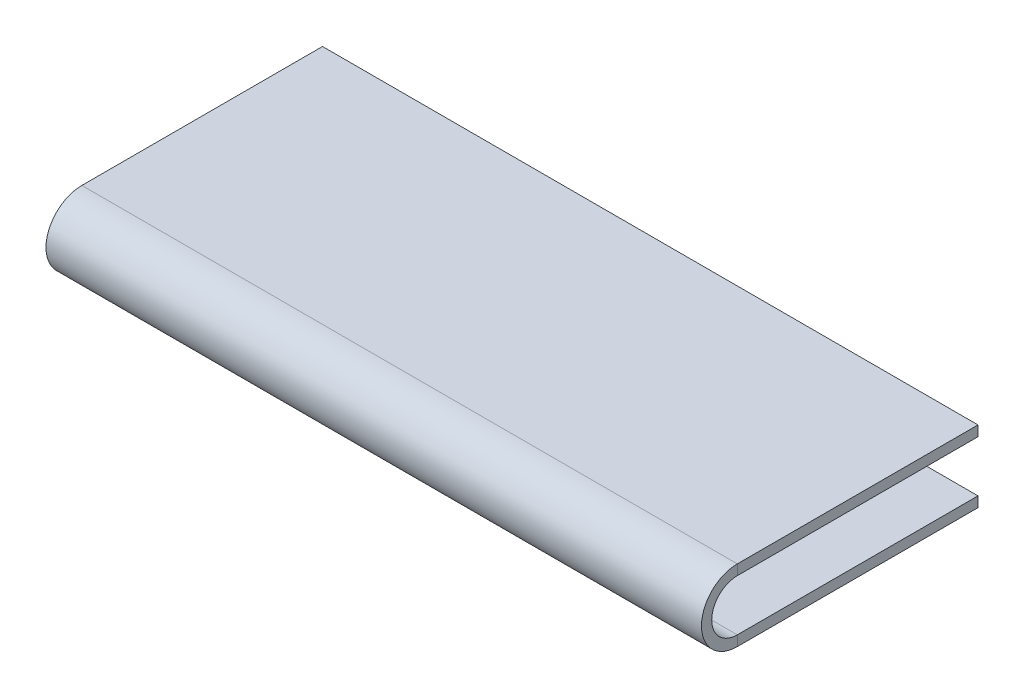
from build123d import *

# Parameters (mm, degrees)
TABAN_FLAN_1_DEPTH = 64


# Sheet-metal steps are written as plain solids
with BuildPart() as part:
    # Çizim1 → Taban-Flanş1 (new body)
    with BuildSketch(Plane.YZ):
        with BuildLine():
            Line((0, 0), (0, 23.5))
            ThreePointArc((0, 23.5), (2.5, 26), (5, 23.5))
            Line((5, 23.5), (5, 0))
            Line((5, 0), (6, 0))
            Line((6, 0), (6, 23.5))
            ThreePointArc((6, 23.5), (2.5, 27), (-1, 23.5))
            Line((-1, 23.5), (-1, 0))
            Line((-1, 0), (0, 0))
        make_face()
    extrude(amount=TABAN_FLAN_1_DEPTH)


solid = part.part
